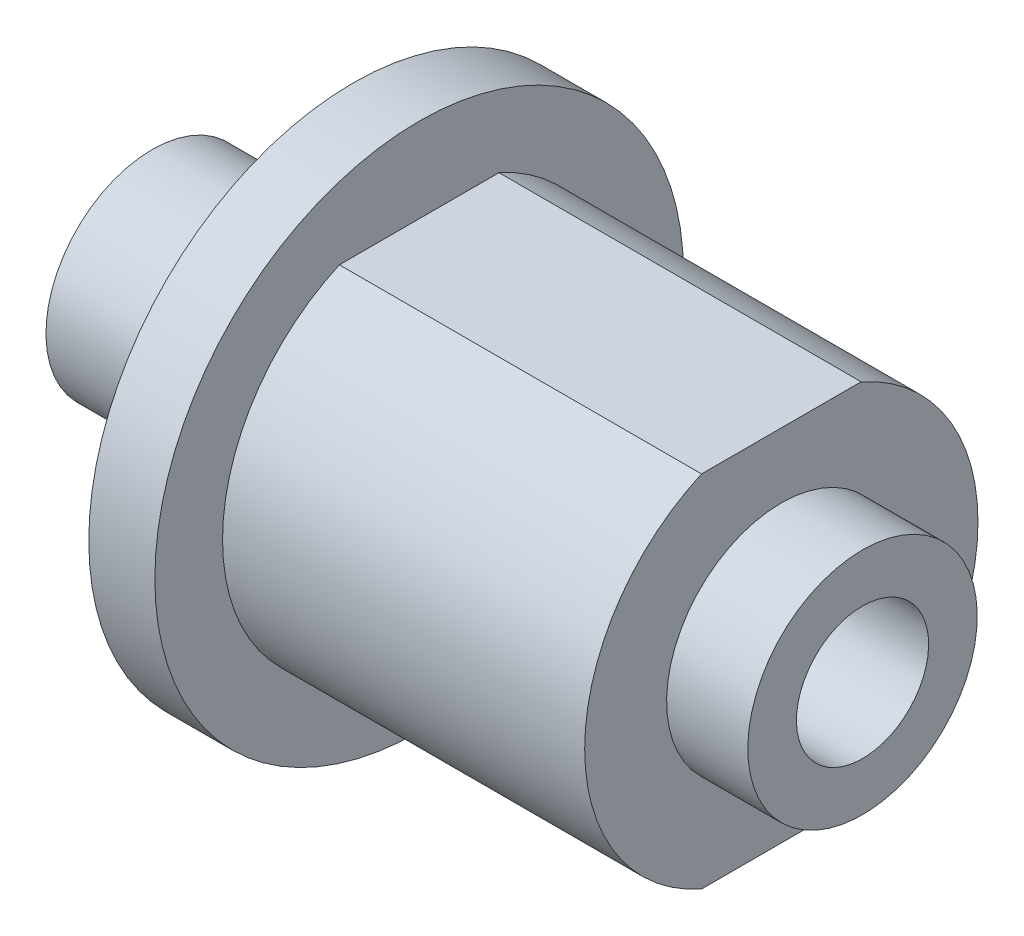
from build123d import *

# Parameters (mm, degrees)
CUT_EXTRUDE1_DEPTH      = 39.565038065
CUT_EXTRUDE1_DEPTH_BACK = 39.565038065
SKETCH2_W               = 17.399
SKETCH2_H               = 0.8128


with BuildPart() as part:
    # Sketch1 → Revolve1 (revolve)
    with BuildSketch(Plane.XY):
        Polygon((0, 5.1054), (0, 3.175), (34.12744, 3.175), (34.12744, 5.5118), (30.226, 5.5118), (30.226, 9.4488), (12.827, 9.4488), (12.827, 12.7), (9.652, 12.7), (9.652, 5.1054), align=None)
    revolve(axis=Axis((34.12744, 0, 0), (-1, 0, 0)))

    # Sketch2 → Cut-Extrude1 (cut, two sides: drawn at the far end of the back side and taken through both)
    with BuildSketch(Plane.XY.offset(-CUT_EXTRUDE1_DEPTH_BACK)):
        with Locations((21.5265, -9.0424)):
            Rectangle(SKETCH2_W, SKETCH2_H)
        with Locations((21.5265, 9.0424)):
            Rectangle(SKETCH2_W, SKETCH2_H)
    extrude(amount=CUT_EXTRUDE1_DEPTH + CUT_EXTRUDE1_DEPTH_BACK, mode=Mode.SUBTRACT)


solid = part.part
